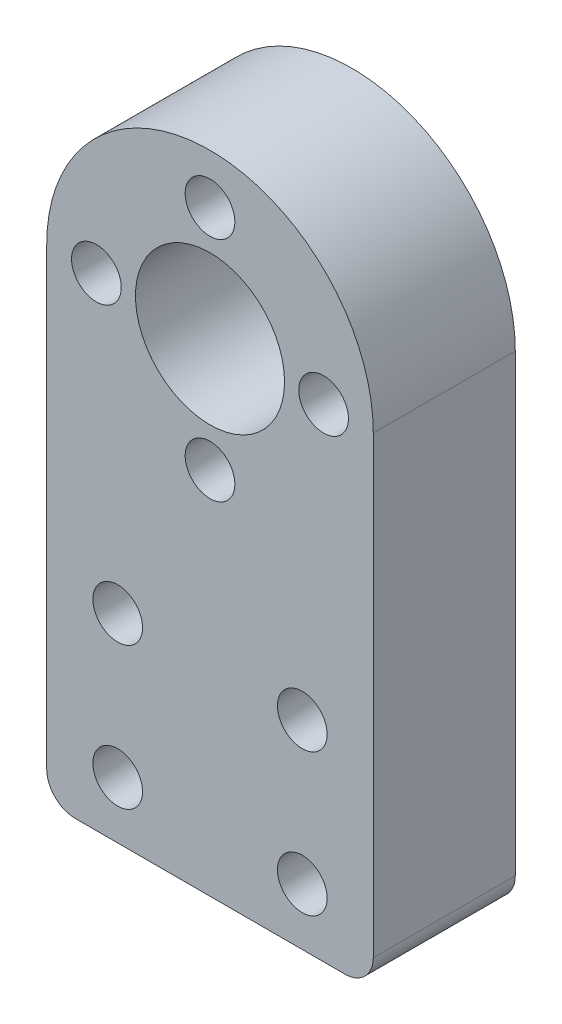
from build123d import *

# Parameters (mm, degrees)
BOSS_EXTRUDE1_DEPTH = 10
CUT_EXTRUDE1_REACH  = 34.319
SKETCH4_R           = 5.25
CUT_EXTRUDE2_REACH  = 34.319
SKETCH6_R           = 1.75
CUT_EXTRUDE3_REACH  = 34.319
SKETCH7_R           = 1.75
FILLET1_R           = 2


with BuildPart() as part:
    # Sketch2 → Boss-Extrude1 (new body)
    with BuildSketch(Plane.XY):
        with BuildLine():
            Line((11.5, -17), (-11.5, -17))
            Line((-11.5, -17), (-11.5, 17))
            ThreePointArc((-11.5, 17), (0, 28.5), (11.5, 17))
            Line((11.5, 17), (11.5, -17))
        make_face()
    extrude(amount=BOSS_EXTRUDE1_DEPTH)

    # Sketch4 → Cut-Extrude1 (cut, up to next)
    with BuildSketch(Plane.XY.offset(10), mode=Mode.PRIVATE) as cut_extrude1_sk1:
        with Locations((0, 17)):
            Circle(SKETCH4_R)
    cut_extrude1_tool1 = extrude(cut_extrude1_sk1.sketch, amount=-CUT_EXTRUDE1_REACH, mode=Mode.PRIVATE) & part.part
    add(cut_extrude1_tool1.solids().sort_by_distance((0, 17, 10))[0], mode=Mode.SUBTRACT)

    # Sketch6 → Cut-Extrude2 (cut, up to next)
    with BuildSketch(Plane(origin=(0, 0, 0), x_dir=(-1, 0, 0), z_dir=(0, 0, -1)), mode=Mode.PRIVATE) as cut_extrude2_sk1:
        with Locations((0, 25)):
            Circle(SKETCH6_R)
    cut_extrude2_tool1 = extrude(cut_extrude2_sk1.sketch, amount=-CUT_EXTRUDE2_REACH, mode=Mode.PRIVATE) & part.part
    # Sketch6 → Cut-Extrude2 (cut, up to next)
    with BuildSketch(Plane(origin=(0, 0, 0), x_dir=(-1, 0, 0), z_dir=(0, 0, -1)), mode=Mode.PRIVATE) as cut_extrude2_sk2:
        with Locations((8, 17)):
            Circle(SKETCH6_R)
    cut_extrude2_tool2 = extrude(cut_extrude2_sk2.sketch, amount=-CUT_EXTRUDE2_REACH, mode=Mode.PRIVATE) & part.part
    # Sketch6 → Cut-Extrude2 (cut, up to next)
    with BuildSketch(Plane(origin=(0, 0, 0), x_dir=(-1, 0, 0), z_dir=(0, 0, -1)), mode=Mode.PRIVATE) as cut_extrude2_sk3:
        with Locations((0, 9)):
            Circle(SKETCH6_R)
    cut_extrude2_tool3 = extrude(cut_extrude2_sk3.sketch, amount=-CUT_EXTRUDE2_REACH, mode=Mode.PRIVATE) & part.part
    # Sketch6 → Cut-Extrude2 (cut, up to next)
    with BuildSketch(Plane(origin=(0, 0, 0), x_dir=(-1, 0, 0), z_dir=(0, 0, -1)), mode=Mode.PRIVATE) as cut_extrude2_sk4:
        with Locations((-8, 17)):
            Circle(SKETCH6_R)
    cut_extrude2_tool4 = extrude(cut_extrude2_sk4.sketch, amount=-CUT_EXTRUDE2_REACH, mode=Mode.PRIVATE) & part.part
    add(cut_extrude2_tool1.solids().sort_by_distance((0, 25, 0))[0], mode=Mode.SUBTRACT)
    add(cut_extrude2_tool2.solids().sort_by_distance((-8, 17, 0))[0], mode=Mode.SUBTRACT)
    add(cut_extrude2_tool3.solids().sort_by_distance((0, 9, 0))[0], mode=Mode.SUBTRACT)
    add(cut_extrude2_tool4.solids().sort_by_distance((8, 17, 0))[0], mode=Mode.SUBTRACT)

    # Sketch7 → Cut-Extrude3 (cut, up to next)
    with BuildSketch(Plane(origin=(0, 0, 0), x_dir=(-1, 0, 0), z_dir=(0, 0, -1)), mode=Mode.PRIVATE) as cut_extrude3_sk1:
        with Locations((-6.5, -3)):
            Circle(SKETCH7_R)
    cut_extrude3_tool1 = extrude(cut_extrude3_sk1.sketch, amount=-CUT_EXTRUDE3_REACH, mode=Mode.PRIVATE) & part.part
    # Sketch7 → Cut-Extrude3 (cut, up to next)
    with BuildSketch(Plane(origin=(0, 0, 0), x_dir=(-1, 0, 0), z_dir=(0, 0, -1)), mode=Mode.PRIVATE) as cut_extrude3_sk2:
        with Locations((6.5, -3)):
            Circle(SKETCH7_R)
    cut_extrude3_tool2 = extrude(cut_extrude3_sk2.sketch, amount=-CUT_EXTRUDE3_REACH, mode=Mode.PRIVATE) & part.part
    # Sketch7 → Cut-Extrude3 (cut, up to next)
    with BuildSketch(Plane(origin=(0, 0, 0), x_dir=(-1, 0, 0), z_dir=(0, 0, -1)), mode=Mode.PRIVATE) as cut_extrude3_sk3:
        with Locations((6.5, -13)):
            Circle(SKETCH7_R)
    cut_extrude3_tool3 = extrude(cut_extrude3_sk3.sketch, amount=-CUT_EXTRUDE3_REACH, mode=Mode.PRIVATE) & part.part
    # Sketch7 → Cut-Extrude3 (cut, up to next)
    with BuildSketch(Plane(origin=(0, 0, 0), x_dir=(-1, 0, 0), z_dir=(0, 0, -1)), mode=Mode.PRIVATE) as cut_extrude3_sk4:
        with Locations((-6.5, -13)):
            Circle(SKETCH7_R)
    cut_extrude3_tool4 = extrude(cut_extrude3_sk4.sketch, amount=-CUT_EXTRUDE3_REACH, mode=Mode.PRIVATE) & part.part
    add(cut_extrude3_tool1.solids().sort_by_distance((6.5, -3, 0))[0], mode=Mode.SUBTRACT)
    add(cut_extrude3_tool2.solids().sort_by_distance((-6.5, -3, 0))[0], mode=Mode.SUBTRACT)
    add(cut_extrude3_tool3.solids().sort_by_distance((-6.5, -13, 0))[0], mode=Mode.SUBTRACT)
    add(cut_extrude3_tool4.solids().sort_by_distance((6.5, -13, 0))[0], mode=Mode.SUBTRACT)

    # Fillet1
    fillet1_edges = [part.edges().sort_by_distance(p)[0] for p in [
        (-11.5, -17, 5),
        (11.5, -17, 5),
    ]]
    fillet(fillet1_edges, radius=FILLET1_R)


solid = part.part
